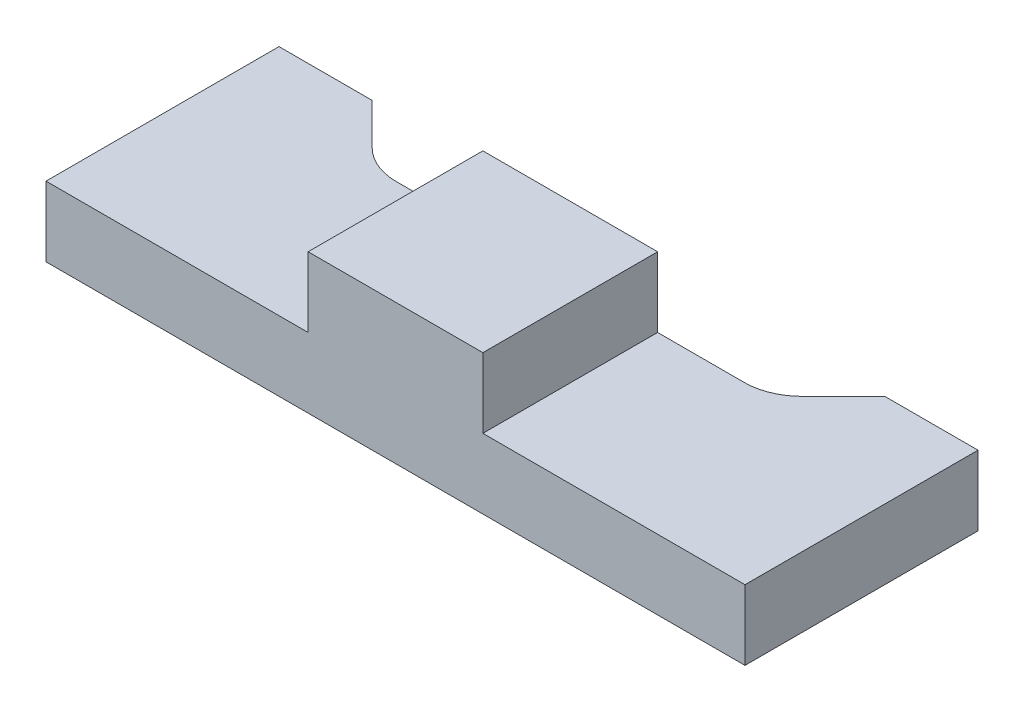
from build123d import *

# Parameters (mm, degrees)
BOSS_EXTRUDE2_DEPTH         = 20
TAP_DRILL_FOR_M6_TAP2_D     = 5
TAP_DRILL_FOR_M6_TAP2_DEPTH = 8
TAP_DRILL_FOR_M6_TAP2_TIP   = 1.502151548
CUT_EXTRUDE1_REACH          = 40
FILLET1_R                   = 5


with BuildPart() as part:
    # Sketch4 → Boss-Extrude2 (new body)
    with BuildSketch(Plane.XY):
        Polygon((-30, 0), (30, 0), (30, 6), (7.5, 6), (7.5, 12), (-7.5, 12), (-7.5, 6), (-30, 6), align=None)
    extrude(amount=BOSS_EXTRUDE2_DEPTH)

    # Tap Drill for M6 Tap2
    with Locations(Plane(origin=(0, 0, 0), x_dir=(-1, 0, 0), z_dir=(0, 0, -1))):
        with Locations((0, 6)):
            Hole(TAP_DRILL_FOR_M6_TAP2_D / 2, depth=TAP_DRILL_FOR_M6_TAP2_DEPTH)
            with Locations((0, 0, -(TAP_DRILL_FOR_M6_TAP2_DEPTH + TAP_DRILL_FOR_M6_TAP2_TIP / 2))):  # 118° drill point
                Cone(0, TAP_DRILL_FOR_M6_TAP2_D / 2, TAP_DRILL_FOR_M6_TAP2_TIP, mode=Mode.SUBTRACT)

    # Sketch7 → Cut-Extrude1 (cut, up to next)
    with BuildSketch(Plane(origin=(0, 12, 0), x_dir=(1, 0, 0), z_dir=(0, 1, 0)), mode=Mode.PRIVATE) as cut_extrude1_sk1:
        Polygon((-22, 0), (22, 0), (17, -5), (-17, -5), align=None)
    cut_extrude1_tool1 = extrude(cut_extrude1_sk1.sketch, amount=-CUT_EXTRUDE1_REACH, mode=Mode.PRIVATE) & part.part
    add(cut_extrude1_tool1.solids().sort_by_distance((0, 12, 2.393162))[0], mode=Mode.SUBTRACT)

    # Fillet1
    fillet1_edges = [part.edges().sort_by_distance(p)[0] for p in [
        (-17, 3, 5),
        (17, 3, 5),
    ]]
    fillet(fillet1_edges, radius=FILLET1_R)


solid = part.part
